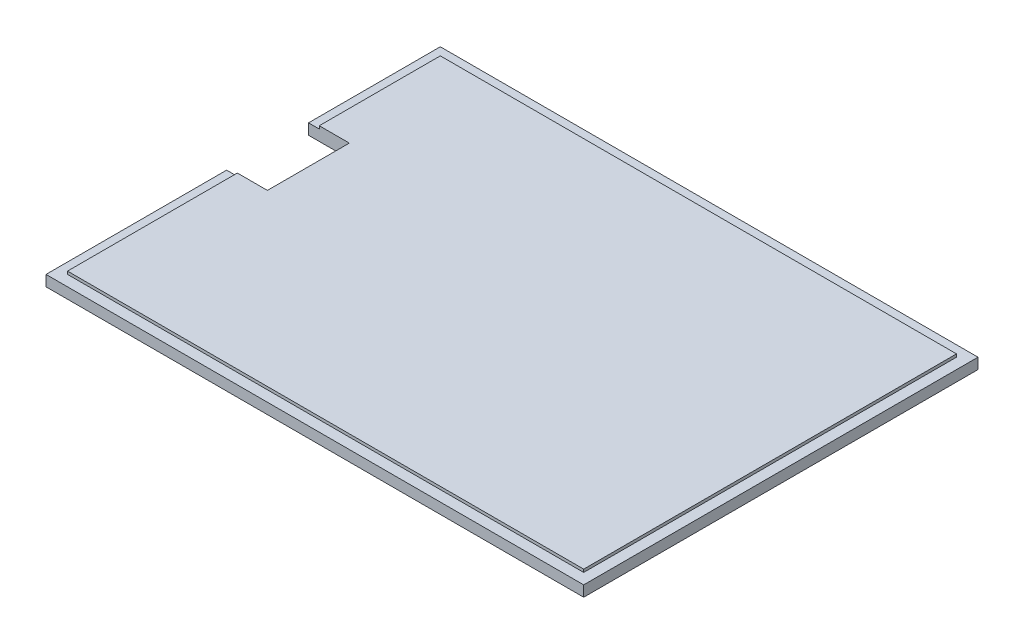
from build123d import *

# Parameters (mm, degrees)
SKETCH1_W           = 750
SKETCH1_H           = 550
BOSS_EXTRUDE1_DEPTH = 19
SKETCH3_W           = 750
SKETCH3_H           = 550
SKETCH3_W_2         = 720
SKETCH3_H_2         = 520
CUT_EXTRUDE2_DEPTH  = 4
SKETCH4_W           = 56.926583049
SKETCH4_H           = 114.263316662
CUT_EXTRUDE3_DEPTH  = 466.414868692


with BuildPart() as part:
    # Sketch1 → Boss-Extrude1 (new body)
    with BuildSketch(Plane(origin=(0, 0, 0), x_dir=(1, 0, 0), z_dir=(0, 1, 0))):
        Rectangle(SKETCH1_W, SKETCH1_H)
    extrude(amount=BOSS_EXTRUDE1_DEPTH)

    # Sketch3 → Cut-Extrude2 (cut)
    with BuildSketch(Plane(origin=(0, 19, 0), x_dir=(1, 0, 0), z_dir=(0, 1, 0))):
        Rectangle(SKETCH3_W, SKETCH3_H)
        Rectangle(SKETCH3_W_2, SKETCH3_H_2, mode=Mode.SUBTRACT)
    extrude(amount=-CUT_EXTRUDE2_DEPTH, mode=Mode.SUBTRACT)

    # Sketch4 → Cut-Extrude3 (cut, through all)
    with BuildSketch(Plane.XZ):
        with Locations((-346.536708476, -34.035881559)):
            Rectangle(SKETCH4_W, SKETCH4_H)
    extrude(amount=-CUT_EXTRUDE3_DEPTH, mode=Mode.SUBTRACT)


solid = part.part
